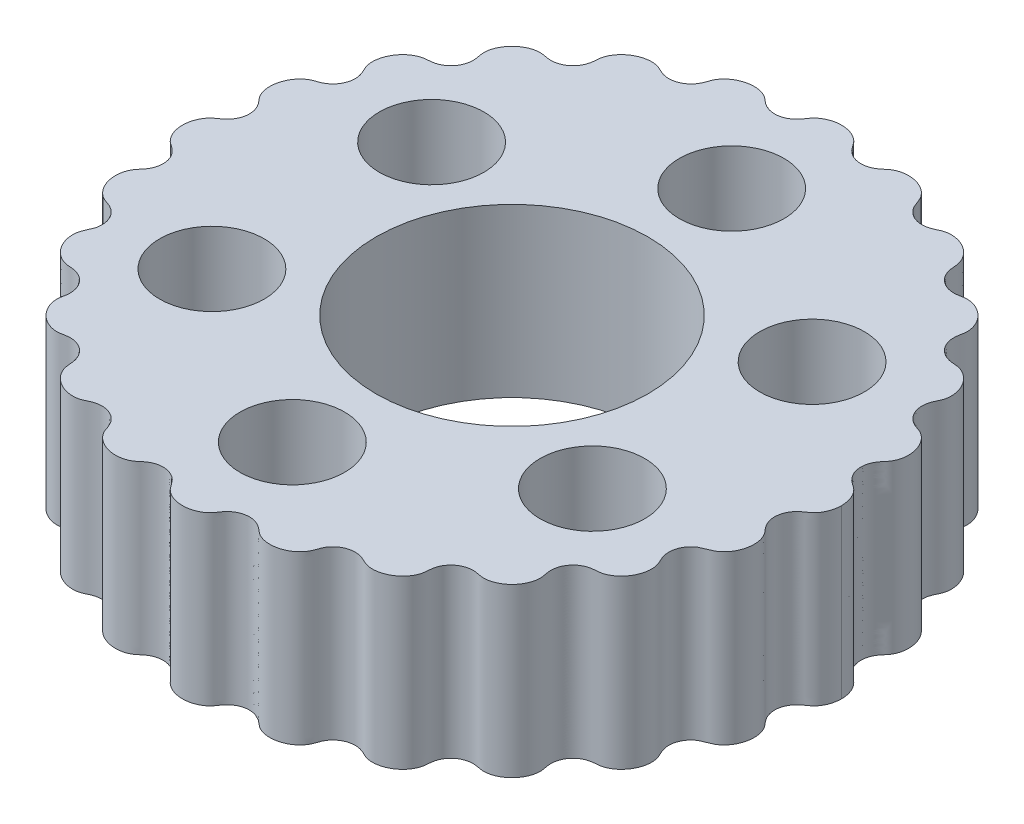
from build123d import *

# Parameters (mm, degrees)
BOSS_EXTRUDE1_DEPTH = 16
SKETCH3_R           = 13
SKETCH3_R_2         = 5
CUT_EXTRUDE1_DEPTH  = 48.333920573


with BuildPart() as part:
    # Sketch2 → Boss-Extrude1 (new body)
    with BuildSketch(Plane(origin=(0, 0, 0), x_dir=(1, 0, 0), z_dir=(0, 1, 0))):
        with BuildLine():
            add(Edge.make_bspline(
                [(31.5, 0), (31.5, 0.018707094), (31.499647262, 0.046556201), (31.49665689, 0.145689227), (31.492288109, 0.224284634), (31.488426988, 0.272324891), (31.468594049, 0.442031488), (31.454667211, 0.52772823), (31.418461905, 0.701318002), (31.391273355, 0.804295531), (31.345438102, 0.953526271), (31.289141961, 1.106553602), (31.196089005, 1.316424665), (31.068457715, 1.537292497), (30.946926271, 1.705519498), (30.843628387, 1.826239224), (30.762921468, 1.910596859), (30.678253622, 1.989375531), (30.606825192, 2.048777709), (30.538136438, 2.101063666), (30.4932005, 2.133440844), (30.416704275, 2.186228387), (30.357541167, 2.225641819), (30.26991417, 2.284659037), (30.176288437, 2.349687287), (30.042956129, 2.451848804), (29.836743046, 2.625837329), (29.560501481, 2.968461803), (29.317106697, 3.427905792), (29.199140575, 4.074961852), (29.271448681, 4.623824701), (29.415596965, 5.010592931), (29.569381549, 5.289588802), (29.691273975, 5.458253228), (29.78640646, 5.57677217), (29.866712574, 5.670412987), (29.933423814, 5.746227647), (29.986065461, 5.807247231), (30.030137995, 5.860427814), (30.068653885, 5.909345981), (30.115777796, 5.972626488), (30.168791174, 6.050595998), (30.228391176, 6.150047539), (30.301265416, 6.289028504), (30.380437742, 6.476042322), (30.454314744, 6.71962428), (30.504625478, 6.977034794), (30.53867243, 7.333244504), (30.517275562, 7.792518497), (30.389407304, 8.335622985), (30.202890123, 8.75881341), (30.012073039, 9.066468876), (29.850671577, 9.278290194), (29.673339984, 9.468643457), (29.515482971, 9.606545168), (29.386020162, 9.702532705), (29.287226838, 9.767656611), (29.186331636, 9.826271954), (29.083773005, 9.878307198), (28.994244377, 9.917446973), (28.919876821, 9.946365071), (28.852099457, 9.970841516), (28.773926011, 9.997620972), (28.690368424, 10.026381799), (28.619069105, 10.051378731), (28.506412616, 10.092834983), (28.331032792, 10.166197003), (28.119618821, 10.281829125), (27.889940929, 10.433963214), (27.549152213, 10.749639827), (27.223664771, 11.277074046), (27.0812132, 11.882898091), (27.105506252, 12.483661877), (27.215572331, 12.820499885), (27.289063003, 13.011150179), (27.343124009, 13.12731914), (27.379727701, 13.203537106), (27.417479849, 13.280175307), (27.450296815, 13.347229076), (27.48163186, 13.414263112), (27.514745075, 13.489645282), (27.550704454, 13.581275799), (27.586189616, 13.689891431), (27.615845108, 13.801743315), (27.639699238, 13.91799579), (27.663480832, 14.078235866), (27.677574755, 14.286902081), (27.668375759, 14.546685699), (27.632675504, 14.810862748), (27.550078854, 15.163297025), (27.382725034, 15.594373399), (27.089111297, 16.068842626), (26.779479958, 16.408723951), (26.503529458, 16.636522936), (26.285917352, 16.782977508), (26.061461985, 16.902963569), (25.873278419, 16.979201764), (25.723294208, 17.026001688), (25.611104227, 17.054117549), (25.518382039, 17.071774542), (25.440017688, 17.083248878), (25.378574488, 17.090554028), (25.310110177, 17.096973528), (25.22787132, 17.103026993), (25.130393196, 17.109281659), (25.004493246, 17.118788414), (24.854920495, 17.135643962), (24.649367755, 17.167372392), (24.337331791, 17.260000558), (23.977200336, 17.421974221), (23.520198806, 17.773124929), (23.156612124, 18.304092176), (23.00101127, 18.80335534), (22.965791133, 19.133359599), (22.965711398, 19.344144187), (22.979806569, 19.540691954), (22.999789475, 19.675678079), (23.019424734, 19.788596299), (23.039444813, 19.890228829), (23.054870625, 19.968002691), (23.069554239, 20.047593584), (23.079840878, 20.111200413), (23.090776729, 20.191853934), (23.099587312, 20.286699024), (23.103638066, 20.401340873), (23.101081254, 20.518483947), (23.088708482, 20.677181064), (23.056028784, 20.880908407), (22.989012557, 21.129405886), (22.863637339, 21.459042263), (22.641985517, 21.8576488), (22.285885215, 22.285889925), (21.857640582, 22.641991984), (21.459034067, 22.863641256), (21.129381178, 22.989021165), (20.880947347, 23.056020102), (20.677118172, 23.088715616), (20.518466803, 23.101083162), (20.401412452, 23.103639965), (20.286513632, 23.099579592), (20.19209143, 23.090787145), (20.111215155, 23.079852234), (20.045769298, 23.069220706), (19.972606138, 23.055853429), (19.886239167, 23.038319628), (19.786531092, 23.019501191), (19.68581314, 23.000197576), (19.492910734, 22.976597455), (19.260745776, 22.953759577), (18.793613935, 23.001396913), (18.297039888, 23.162947416), (17.785332438, 23.507774745), (17.412459245, 23.99044059), (17.263155458, 24.333162046), (17.168237051, 24.640867018), (17.133578916, 24.869736928), (17.119620797, 25.000252789), (17.109701415, 25.120477754), (17.102493903, 25.232130819), (17.096572727, 25.315065084), (17.090717266, 25.37802527), (17.083450976, 25.439181097), (17.072038213, 25.516771393), (17.05398843, 25.611408027), (17.025760726, 25.724063306), (16.979255658, 25.873242048), (16.903122822, 26.061120923), (16.782850555, 26.286101465), (16.636489449, 26.503584653), (16.408815362, 26.779383052), (16.068762705, 27.089175387), (15.594398504, 27.382714196), (15.16327968, 27.550076435), (14.810737134, 27.632711402), (14.546865619, 27.668358062), (14.287012742, 27.677557479), (14.077630121, 27.663431328), (13.918102008, 27.639760631), (13.80256874, 27.616020894), (13.690105471, 27.586213226), (13.580058849, 27.550210029), (13.489570299, 27.514826825), (13.413751161, 27.481503046), (13.353577227, 27.453273338), (13.281006433, 27.417548263), (13.197445605, 27.376648166), (13.119241857, 27.339271837), (13.02011704, 27.29441653), (12.855661579, 27.225158663), (12.607383331, 27.151995791), (12.340695833, 27.09999412), (11.886056357, 27.078879285), (11.261031206, 27.2316896), (10.763941968, 27.53905273), (10.325474825, 28.005814077), (10.185596311, 28.30178572), (10.094298451, 28.498277078), (10.051754503, 28.618732512), (10.024921396, 28.694050535), (9.996058414, 28.779102778), (9.972222446, 28.84864923), (9.947599393, 28.916532694), (9.916694184, 28.995825456), (9.877868629, 29.084673245), (9.826423827, 29.186144182), (9.767869818, 29.286913953), (9.702636207, 29.385843007), (9.606359908, 29.5156837), (9.468580068, 29.673419233), (9.278424448, 29.850564623), (9.066408547, 30.01210438), (8.758782836, 30.202914134), (8.335593913, 30.389402498), (7.79259839, 30.517274158), (7.333098516, 30.538669052), (6.977124096, 30.50463937), (6.719698522, 30.454322357), (6.4756844, 30.380318513), (6.289249372, 30.301389215), (6.150363892, 30.228533705), (6.050683208, 30.168805347), (5.971469846, 30.114982712), (5.908473019, 30.068109694), (5.861891188, 30.031401251), (5.811207973, 29.989304802), (5.743867349, 29.931048872), (5.665135266, 29.86229659), (5.580543, 29.789850881), (5.463767338, 29.695020698), (5.281380569, 29.563529418), (5.007353095, 29.415571608), (4.638388151, 29.273995931), (4.061846392, 29.19861853), (3.431247037, 29.317594955), (2.970472505, 29.558438773), (2.62256037, 29.839836748), (2.454891221, 30.039574526), (2.347470149, 30.17902247), (2.284971682, 30.269681791), (2.228441447, 30.353122914), (2.180903624, 30.424577141), (2.137596211, 30.487355575), (2.099130996, 30.540713578), (2.04987394, 30.605380869), (1.988900893, 30.678873324), (1.91086959, 30.762609033), (1.826200532, 30.843666056), (1.705187844, 30.947169148), (1.538043831, 31.06810619), (1.314953579, 31.196426526), (0.993195123, 31.340868698), (0.55461386, 31.465991025), (1.3458e-05, 31.51700619), (-0.554648335, 31.465986218), (-0.993160441, 31.340880639), (-1.315020838, 31.196394278), (-1.537975243, 31.068150749), (-1.705140294, 30.947203987), (-1.826479699, 30.843417186), (-1.910504036, 30.763001104), (-1.989141691, 30.678582026), (-2.049855661, 30.605380436), (-2.099254715, 30.540583738), (-2.137292047, 30.487757306), (-2.181162988, 30.424217119), (-2.228152849, 30.35350908), (-2.285422691, 30.269090183), (-2.346439208, 30.180265932), (-2.456774176, 30.03763177), (-2.621017483, 29.840734466), (-2.973163662, 29.556907603), (-3.429154343, 29.318331745), (-4.064140363, 29.198352639), (-4.637053026, 29.274134604), (-5.004379998, 29.413928941), (-5.287834706, 29.567102379), (-5.463238562, 29.695454253), (-5.571993203, 29.782432829), (-5.676028024, 29.871437525), (-5.742069288, 29.929950095), (-5.808323452, 29.986922943), (-5.860680607, 30.030341802), (-5.909179807, 30.068537732), (-5.972552428, 30.115722519), (-6.050673233, 30.16884468), (-6.149981102, 30.228351631), (-6.289071501, 30.301285395), (-6.476023364, 30.38043206), (-6.719616391, 30.454312866), (-6.977037099, 30.50462527), (-7.333237984, 30.538671755), (-7.792514569, 30.517280726), (-8.335638951, 30.389394199), (-8.758780576, 30.20291333), (-9.066418305, 30.012098079), (-9.278426851, 29.85056252), (-9.46858503, 29.673414241), (-9.606363682, 29.515679049), (-9.702638947, 29.385839032), (-9.767872607, 29.286909354), (-9.82642703, 29.186138331), (-9.877871176, 29.084667964), (-9.916695217, 28.99582297), (-9.94760195, 28.916525669), (-9.972225992, 28.848639404), (-9.996059933, 28.77909803), (-10.024926978, 28.694034283), (-10.051760169, 28.618716419), (-10.094310899, 28.49824558), (-10.185613358, 28.301749322), (-10.325538885, 28.005704477), (-10.764098415, 27.538921342), (-11.261252288, 27.231594134), (-11.886279632, 27.078863489), (-12.340819504, 27.100012945), (-12.607466404, 27.152016159), (-12.855711115, 27.225178051), (-13.0201416, 27.294427328), (-13.119257301, 27.339279092), (-13.19745906, 27.376654687), (-13.281015858, 27.417552938), (-13.3535838, 27.453276503), (-13.413756432, 27.481505442), (-13.489575603, 27.514829018), (-13.580063909, 27.550211841), (-13.690110718, 27.58621478), (-13.80257409, 27.616022151), (-13.918107531, 27.639761607), (-14.077635923, 27.663431926), (-14.287018777, 27.677557573), (-14.546871791, 27.668357535), (-14.810743362, 27.632710252), (-15.163285859, 27.550074468), (-15.594404383, 27.382711265), (-16.068767936, 27.089171443), (-16.408819835, 26.779378432), (-16.636493185, 26.503579652), (-16.782853699, 26.286096247), (-16.903125324, 26.061115586), (-16.97925757, 25.873236783), (-17.025762208, 25.724058035), (-17.053989604, 25.611402695), (-17.07203913, 25.516766046), (-17.083451721, 25.439175497), (-17.090717881, 25.378019448), (-17.096573251, 25.315058649), (-17.102494514, 25.232121311), (-17.109702453, 25.12046261), (-17.119622507, 25.00023447), (-17.133582798, 24.869702756), (-17.168250366, 24.640801459), (-17.26319143, 24.333060878), (-17.412549644, 23.990274243), (-17.785514256, 23.507604546), (-18.297233068, 23.162856831), (-18.793784893, 23.001364142), (-19.26081645, 22.953766551), (-19.492956615, 22.976600526), (-19.685836451, 23.000202126), (-19.786548779, 23.019504321), (-19.886251096, 23.03832222), (-19.97261152, 23.055854337), (-20.045779535, 23.069222559), (-20.111219163, 23.079852879), (-20.192095403, 23.090787579), (-20.286520203, 23.099579938), (-20.401418711, 23.103640023), (-20.518471861, 23.10108296), (-20.677123085, 23.088715032), (-20.880954852, 23.056018405), (-21.129384458, 22.989020184), (-21.459044481, 22.863635988), (-21.857630179, 22.641999602), (-22.285915131, 22.285863889), (-22.641959654, 21.857673241), (-22.863671054, 21.458987284), (-22.98895211, 21.129559949), (-23.056078325, 20.880669708), (-23.088742703, 20.677093965), (-23.101061429, 20.518846029), (-23.103601878, 20.4017267), (-23.099537367, 20.28621507), (-23.090649455, 20.19024056), (-23.080017934, 20.111759198), (-23.070054341, 20.05061728), (-23.055592354, 19.972767304), (-23.037197273, 19.879769135), (-23.01928136, 19.786068677), (-23.001785663, 19.688475258), (-22.979040094, 19.537046699), (-22.96559183, 19.338063571), (-22.966114004, 19.134262477), (-22.999939902, 18.807131995), (-23.157459801, 18.301816105), (-23.52040981, 17.77327795), (-23.977206223, 17.421830088), (-24.338164535, 17.259756224), (-24.647622142, 17.167809819), (-24.858552581, 17.135071296), (-25.001503955, 17.119147939), (-25.133170375, 17.10897628), (-25.225856707, 17.103243141), (-25.310480029, 17.096915039), (-25.378788938, 17.090531514), (-25.440024212, 17.083251018), (-25.518317582, 17.071788203), (-25.611106746, 17.054115969), (-25.723313751, 17.025994976), (-25.873288978, 16.979198329), (-26.06145902, 16.902965244), (-26.285925761, 16.782972343), (-26.503534142, 16.63651936), (-26.779484223, 16.408719801), (-27.089114926, 16.068838089), (-27.382728496, 15.594366284), (-27.55008053, 15.163291851), (-27.632676674, 14.810856179), (-27.668376356, 14.546679086), (-27.677574677, 14.28689666), (-27.663480225, 14.078230134), (-27.639698144, 13.917989693), (-27.615843959, 13.801738065), (-27.586187913, 13.689886253), (-27.550703943, 13.581273503), (-27.514738724, 13.489630329), (-27.481632679, 13.414264921), (-27.450291029, 13.347216921), (-27.417476386, 13.280168569), (-27.379722236, 13.203525389), (-27.343114534, 13.127301662), (-27.289051299, 13.01111393), (-27.215555209, 12.820488005), (-27.105484879, 12.483467351), (-27.081216566, 11.882857487), (-27.223777759, 11.276375639), (-27.550180323, 10.748896067), (-27.886466791, 10.436796851), (-28.120932897, 10.28058799), (-28.338778382, 10.162644571), (-28.49847929, 10.096433273), (-28.614178059, 10.0527583), (-28.699951051, 10.02302444), (-28.776082366, 9.99714893), (-28.848148816, 9.972366836), (-28.917467906, 9.947238917), (-28.995372355, 9.916885157), (-29.084786121, 9.87781913), (-29.18610479, 9.826442887), (-29.286893189, 9.767881822), (-29.385875083, 9.702611738), (-29.5156847, 9.606362573), (-29.67339608, 9.468601417), (-29.850576055, 9.278410279), (-30.012100231, 9.066415949), (-30.202910728, 8.758784459), (-30.389396418, 8.335636283), (-30.51728161, 7.792503757), (-30.538671598, 7.333246105), (-30.504623278, 6.977020829), (-30.45431327, 6.71961533), (-30.380441583, 6.476053181), (-30.301256517, 6.28901189), (-30.228383888, 6.150032987), (-30.168792887, 6.050597334), (-30.115795311, 5.972651609), (-30.068635623, 5.909324412), (-30.0301115, 5.860395243), (-29.985940984, 5.807085262), (-29.934168434, 5.74714131), (-29.865200685, 5.668580967), (-29.788217462, 5.57896471), (-29.689207143, 5.455812638), (-29.569864061, 5.289453397), (-29.417480631, 5.015248827), (-29.269339276, 4.618685495), (-29.200834263, 4.070138577), (-29.313120901, 3.438085626), (-29.565518504, 2.959912331), (-29.764051688, 2.715914833), (-29.916302218, 2.561483293), (-30.070399807, 2.428690335), (-30.180832373, 2.347374813), (-30.261379686, 2.290484499), (-30.352313245, 2.228732356), (-30.429649463, 2.177329542), (-30.488648652, 2.136835153), (-30.538756061, 2.100661647), (-30.604553838, 2.050501522), (-30.680084104, 1.987771216), (-30.762597886, 1.910938511), (-30.843077969, 1.826843938), (-30.947805994, 1.704397103), (-31.06762577, 1.538673049), (-31.196574662, 1.314833698), (-31.341036912, 0.992786711), (-31.466492172, 0.55090606), (-31.5, 0.183219945), (-31.5, 0)],
                knots=[0.071647033, 0.071647033, 0.071647033, 0.071647033, 0.07248366, 0.073320287, 0.074156914, 0.07499354, 0.076666794, 0.078340048, 0.080013302, 0.081686556, 0.083359809, 0.085033063, 0.088379571, 0.091726078, 0.095072586, 0.096745839, 0.098419093, 0.100092347, 0.101765601, 0.102602228, 0.103438855, 0.104275481, 0.105112108, 0.105530422, 0.105948735, 0.106367049, 0.106785362, 0.106994519, 0.107203676, 0.107412832, 0.107621989, 0.107831146, 0.108040302, 0.108458616, 0.108876929, 0.109295243, 0.11013187, 0.110968497, 0.111805123, 0.11264175, 0.113478377, 0.115151631, 0.116824885, 0.118498138, 0.121844646, 0.125191154, 0.128537661, 0.131884169, 0.138577184, 0.145270199, 0.151963214, 0.155309721, 0.158656229, 0.162002737, 0.165349244, 0.167022498, 0.168695752, 0.170369005, 0.172042259, 0.173715513, 0.17455214, 0.175388767, 0.176225394, 0.176643707, 0.17706202, 0.177480334, 0.177898647, 0.178107804, 0.178316961, 0.178526117, 0.178735274, 0.178944431, 0.179153588, 0.179571901, 0.179990215, 0.180408528, 0.180826841, 0.181245155, 0.182081782, 0.182918409, 0.183755036, 0.185428289, 0.187101543, 0.188774797, 0.190448051, 0.192121304, 0.195467812, 0.198814319, 0.202160827, 0.205507335, 0.21220035, 0.218893365, 0.22558638, 0.228932887, 0.232279395, 0.235625902, 0.23897241, 0.240645664, 0.242318917, 0.243992171, 0.244828798, 0.245665425, 0.246502052, 0.247338679, 0.248175306, 0.248593619, 0.249011933, 0.249430246, 0.249639403, 0.249848559, 0.250057716, 0.250266873, 0.25047603, 0.250685186, 0.250894343, 0.2511035, 0.251521813, 0.251940127, 0.25235844, 0.253195067, 0.254031694, 0.254868321, 0.255704948, 0.257378201, 0.259051455, 0.260724709, 0.262397963, 0.26574447, 0.269090978, 0.272437485, 0.2791305, 0.285823515, 0.292516531, 0.299209546, 0.302556053, 0.305902561, 0.309249068, 0.310922322, 0.312595576, 0.31426883, 0.315942083, 0.31677871, 0.317615337, 0.318451964, 0.319288591, 0.319706904, 0.320125218, 0.320543531, 0.320961845, 0.321171001, 0.321380158, 0.321589315, 0.321798472, 0.322007628, 0.322216785, 0.322635098, 0.323053412, 0.323471725, 0.324308352, 0.325144979, 0.325981606, 0.326818233, 0.32765486, 0.329328114, 0.331001367, 0.332674621, 0.336021129, 0.339367636, 0.342714144, 0.346060651, 0.352753666, 0.359446681, 0.366139696, 0.369486204, 0.372832712, 0.376179219, 0.379525727, 0.38119898, 0.382872234, 0.384545488, 0.386218742, 0.387891995, 0.388728622, 0.389565249, 0.390401876, 0.39082019, 0.391238503, 0.391656816, 0.39207513, 0.392284287, 0.392493443, 0.3927026, 0.392911757, 0.393120913, 0.39333007, 0.393748384, 0.394166697, 0.394585011, 0.395003324, 0.395421637, 0.396258264, 0.397094891, 0.397931518, 0.399604772, 0.401278026, 0.402951279, 0.404624533, 0.406297787, 0.409644294, 0.412990802, 0.41633731, 0.419683817, 0.426376832, 0.433069847, 0.439762862, 0.44310937, 0.446455877, 0.449802385, 0.453148892, 0.454822146, 0.4564954, 0.458168654, 0.459005281, 0.459841908, 0.460678534, 0.461515161, 0.462351788, 0.462770102, 0.463188415, 0.463606729, 0.463815885, 0.464025042, 0.464234199, 0.464443355, 0.464652512, 0.464861669, 0.465279982, 0.465698296, 0.466116609, 0.466534923, 0.46737155, 0.468208176, 0.469044803, 0.46988143, 0.471554684, 0.473227938, 0.474901192, 0.476574445, 0.479920953, 0.48326746, 0.486613968, 0.493306983, 0.499999998, 0.506693013, 0.513386028, 0.516732536, 0.520079043, 0.523425551, 0.525098805, 0.526772058, 0.528445312, 0.530118566, 0.530955193, 0.53179182, 0.532628447, 0.533465073, 0.533883387, 0.5343017, 0.534720014, 0.535138327, 0.535347484, 0.535556641, 0.535765797, 0.535974954, 0.536184111, 0.536393268, 0.536811581, 0.537229894, 0.537648208, 0.538484835, 0.539321462, 0.540158089, 0.540994715, 0.541831342, 0.543504596, 0.54517785, 0.546851104, 0.550197611, 0.553544119, 0.556890626, 0.560237134, 0.566930149, 0.573623164, 0.580316179, 0.583662687, 0.587009194, 0.590355702, 0.593702209, 0.595375463, 0.597048717, 0.59872197, 0.600395224, 0.602068478, 0.602905105, 0.603741732, 0.604578359, 0.604996672, 0.605414986, 0.605833299, 0.606251612, 0.606669926, 0.606879083, 0.607088239, 0.607297396, 0.607506553, 0.60771571, 0.607924866, 0.60834318, 0.608761493, 0.609179807, 0.60959812, 0.610434747, 0.611271374, 0.612108001, 0.613781254, 0.615454508, 0.617127762, 0.618801016, 0.62047427, 0.623820777, 0.627167285, 0.630513792, 0.6338603, 0.640553315, 0.64724633, 0.653939345, 0.657285852, 0.66063236, 0.663978868, 0.667325375, 0.668998629, 0.670671883, 0.672345136, 0.673181763, 0.67401839, 0.674855017, 0.675691644, 0.676528271, 0.676946584, 0.677364898, 0.677783211, 0.677992368, 0.678201525, 0.678410681, 0.678619838, 0.678828995, 0.679038151, 0.679456465, 0.679874778, 0.680293092, 0.680711405, 0.681548032, 0.682384659, 0.683221286, 0.684057913, 0.685731167, 0.68740442, 0.689077674, 0.690750928, 0.694097435, 0.697443943, 0.70079045, 0.707483466, 0.714176481, 0.720869496, 0.727562511, 0.730909018, 0.734255526, 0.737602033, 0.739275287, 0.740948541, 0.742621795, 0.744295048, 0.745131675, 0.745968302, 0.746804929, 0.747641556, 0.748059869, 0.748478183, 0.748896496, 0.749105653, 0.74931481, 0.749523967, 0.749733123, 0.74994228, 0.750151437, 0.750360593, 0.75056975, 0.750988064, 0.751406377, 0.75182469, 0.752661317, 0.753497944, 0.754334571, 0.755171198, 0.756007825, 0.757681079, 0.759354332, 0.761027586, 0.764374094, 0.767720601, 0.771067109, 0.774413616, 0.781106631, 0.787799647, 0.794492662, 0.797839169, 0.801185677, 0.804532184, 0.807878692, 0.809551946, 0.811225199, 0.812898453, 0.814571707, 0.816244961, 0.817081587, 0.817918214, 0.818754841, 0.819173155, 0.819591468, 0.820009782, 0.820428095, 0.820846408, 0.821055565, 0.821264722, 0.821473879, 0.821683035, 0.821892192, 0.822101349, 0.822519662, 0.822937976, 0.823356289, 0.823774603, 0.824611229, 0.825447856, 0.826284483, 0.827957737, 0.829630991, 0.831304245, 0.832977498, 0.834650752, 0.83799726, 0.841343767, 0.844690275, 0.848036782, 0.854729797, 0.861422812, 0.868115827, 0.871462335, 0.874808843, 0.87815535, 0.881501858, 0.883175111, 0.884848365, 0.886521619, 0.887358246, 0.888194873, 0.8890315, 0.889868126, 0.890704753, 0.891123067, 0.89154138, 0.891959694, 0.89216885, 0.892378007, 0.892587164, 0.892796321, 0.893005477, 0.893214634, 0.893423791, 0.893632947, 0.894051261, 0.894469574, 0.894887888, 0.895724515, 0.896561142, 0.897397768, 0.898234395, 0.899907649, 0.901580903, 0.903254157, 0.90492741, 0.908273918, 0.911620426, 0.914966933, 0.921659948, 0.928352963, 0.928352963, 0.928352963, 0.928352963], degree=3))
            add(Edge.make_bspline(
                [(-31.5, 0), (-31.5, -0.183219945), (-31.466492172, -0.55090606), (-31.341036912, -0.992786711), (-31.196574662, -1.314833698), (-31.06762577, -1.538673049), (-30.947805994, -1.704397103), (-30.843077969, -1.826843938), (-30.762597886, -1.910938511), (-30.680084104, -1.987771216), (-30.604553838, -2.050501522), (-30.538756061, -2.100661647), (-30.488648652, -2.136835153), (-30.429649463, -2.177329542), (-30.352313245, -2.228732356), (-30.261379686, -2.290484499), (-30.180832373, -2.347374813), (-30.070399807, -2.428690335), (-29.916302218, -2.561483293), (-29.764051688, -2.715914833), (-29.565518504, -2.959912331), (-29.313120901, -3.438085626), (-29.200834263, -4.070138577), (-29.269339276, -4.618685495), (-29.417480631, -5.015248827), (-29.569864061, -5.289453397), (-29.689207143, -5.455812638), (-29.788217462, -5.57896471), (-29.865200685, -5.668580967), (-29.934168434, -5.74714131), (-29.985940984, -5.807085262), (-30.0301115, -5.860395243), (-30.068635623, -5.909324412), (-30.115795311, -5.972651609), (-30.168792887, -6.050597334), (-30.228383888, -6.150032987), (-30.301256517, -6.28901189), (-30.380441583, -6.476053181), (-30.45431327, -6.71961533), (-30.504623278, -6.977020829), (-30.538671598, -7.333246105), (-30.51728161, -7.792503757), (-30.389396418, -8.335636283), (-30.202910728, -8.758784459), (-30.012100231, -9.066415949), (-29.850576055, -9.278410279), (-29.67339608, -9.468601417), (-29.5156847, -9.606362573), (-29.385875083, -9.702611738), (-29.286893189, -9.767881822), (-29.18610479, -9.826442887), (-29.084786121, -9.87781913), (-28.995372355, -9.916885157), (-28.917467906, -9.947238917), (-28.848148816, -9.972366836), (-28.776082366, -9.99714893), (-28.699951051, -10.02302444), (-28.614178059, -10.0527583), (-28.49847929, -10.096433273), (-28.338778382, -10.162644571), (-28.120932897, -10.28058799), (-27.886466791, -10.436796851), (-27.550180323, -10.748896067), (-27.223777759, -11.276375639), (-27.081216566, -11.882857487), (-27.105484879, -12.483467351), (-27.215555209, -12.820488005), (-27.289051299, -13.01111393), (-27.343114534, -13.127301662), (-27.379722236, -13.203525389), (-27.417476386, -13.280168569), (-27.450291029, -13.347216921), (-27.481632679, -13.414264921), (-27.514738724, -13.489630329), (-27.550703943, -13.581273503), (-27.586187913, -13.689886253), (-27.615843959, -13.801738065), (-27.639698144, -13.917989693), (-27.663480225, -14.078230134), (-27.677574677, -14.28689666), (-27.668376356, -14.546679086), (-27.632676674, -14.810856179), (-27.55008053, -15.163291851), (-27.382728496, -15.594366284), (-27.089114926, -16.068838089), (-26.779484223, -16.408719801), (-26.503534142, -16.63651936), (-26.285925761, -16.782972343), (-26.06145902, -16.902965244), (-25.873288978, -16.979198329), (-25.723313751, -17.025994976), (-25.611106746, -17.054115969), (-25.518317582, -17.071788203), (-25.440024212, -17.083251018), (-25.378788938, -17.090531514), (-25.310480029, -17.096915039), (-25.225856707, -17.103243141), (-25.133170375, -17.10897628), (-25.001503955, -17.119147939), (-24.858552581, -17.135071296), (-24.647622142, -17.167809819), (-24.338164535, -17.259756224), (-23.977206223, -17.421830088), (-23.52040981, -17.77327795), (-23.157459801, -18.301816105), (-22.999939902, -18.807131995), (-22.966114003, -19.134262477), (-22.96559183, -19.338063571), (-22.979040094, -19.537046699), (-23.001785663, -19.688475258), (-23.01928136, -19.786068677), (-23.037197273, -19.879769135), (-23.055592354, -19.972767304), (-23.070054341, -20.05061728), (-23.080017934, -20.111759198), (-23.090649455, -20.19024056), (-23.099537367, -20.28621507), (-23.103601878, -20.4017267), (-23.101061429, -20.518846029), (-23.088742703, -20.677093965), (-23.056078325, -20.880669708), (-22.98895211, -21.129559949), (-22.863671054, -21.458987284), (-22.641959654, -21.857673241), (-22.285915131, -22.285863889), (-21.857630179, -22.641999602), (-21.459044481, -22.863635988), (-21.129384458, -22.989020184), (-20.880954852, -23.056018405), (-20.677123085, -23.088715032), (-20.518471861, -23.10108296), (-20.401418711, -23.103640023), (-20.286520203, -23.099579938), (-20.192095403, -23.090787579), (-20.111219163, -23.079852879), (-20.045779535, -23.069222559), (-19.97261152, -23.055854337), (-19.886251096, -23.03832222), (-19.786548779, -23.019504321), (-19.685836451, -23.000202126), (-19.492956615, -22.976600526), (-19.26081645, -22.953766551), (-18.793784893, -23.001364142), (-18.297233068, -23.162856831), (-17.785514256, -23.507604546), (-17.412549644, -23.990274243), (-17.26319143, -24.333060878), (-17.168250366, -24.640801459), (-17.133582798, -24.869702756), (-17.119622507, -25.00023447), (-17.109702453, -25.12046261), (-17.102494514, -25.232121311), (-17.096573251, -25.315058649), (-17.090717881, -25.378019448), (-17.083451721, -25.439175497), (-17.07203913, -25.516766046), (-17.053989604, -25.611402695), (-17.025762208, -25.724058035), (-16.97925757, -25.873236783), (-16.903125324, -26.061115586), (-16.782853699, -26.286096247), (-16.636493185, -26.503579652), (-16.408819835, -26.779378432), (-16.068767936, -27.089171443), (-15.594404383, -27.382711265), (-15.163285859, -27.550074468), (-14.810743362, -27.632710252), (-14.546871791, -27.668357535), (-14.287018777, -27.677557573), (-14.077635923, -27.663431926), (-13.918107531, -27.639761607), (-13.80257409, -27.616022151), (-13.690110718, -27.58621478), (-13.580063909, -27.550211841), (-13.489575603, -27.514829018), (-13.413756432, -27.481505442), (-13.353583799, -27.453276503), (-13.281015858, -27.417552938), (-13.19745906, -27.376654687), (-13.119257301, -27.339279092), (-13.0201416, -27.294427328), (-12.855711115, -27.225178051), (-12.607466404, -27.152016159), (-12.340819504, -27.100012945), (-11.886279632, -27.078863489), (-11.261252288, -27.231594134), (-10.764098415, -27.538921342), (-10.325538885, -28.005704477), (-10.185613358, -28.301749322), (-10.094310899, -28.49824558), (-10.051760169, -28.618716419), (-10.024926978, -28.694034283), (-9.996059933, -28.77909803), (-9.972225992, -28.848639404), (-9.94760195, -28.916525669), (-9.916695217, -28.99582297), (-9.877871176, -29.084667964), (-9.82642703, -29.186138331), (-9.767872607, -29.286909354), (-9.702638947, -29.385839032), (-9.606363682, -29.515679049), (-9.46858503, -29.673414241), (-9.278426851, -29.85056252), (-9.066418305, -30.012098079), (-8.758780576, -30.20291333), (-8.335638951, -30.389394199), (-7.792514569, -30.517280726), (-7.333237984, -30.538671755), (-6.977037099, -30.50462527), (-6.719616391, -30.454312866), (-6.476023364, -30.38043206), (-6.289071501, -30.301285395), (-6.149981102, -30.228351631), (-6.050673233, -30.16884468), (-5.972552428, -30.115722519), (-5.909179807, -30.068537732), (-5.860680607, -30.030341802), (-5.808323452, -29.986922943), (-5.742069288, -29.929950095), (-5.676028024, -29.871437525), (-5.571993203, -29.782432829), (-5.463238562, -29.695454253), (-5.287834706, -29.567102379), (-5.004379998, -29.413928941), (-4.637053026, -29.274134604), (-4.064140363, -29.198352639), (-3.429154343, -29.318331745), (-2.973163662, -29.556907603), (-2.621017483, -29.840734466), (-2.456774176, -30.03763177), (-2.346439208, -30.180265932), (-2.285422691, -30.269090183), (-2.228152849, -30.35350908), (-2.181162988, -30.424217119), (-2.137292047, -30.487757306), (-2.099254715, -30.540583738), (-2.049855661, -30.605380436), (-1.989141691, -30.678582026), (-1.910504036, -30.763001104), (-1.826479699, -30.843417186), (-1.705140294, -30.947203987), (-1.537975243, -31.068150749), (-1.315020838, -31.196394278), (-0.993160441, -31.340880639), (-0.554648335, -31.465986218), (1.3458e-05, -31.51700619), (0.55461386, -31.465991025), (0.993195123, -31.340868698), (1.314953579, -31.196426526), (1.538043831, -31.06810619), (1.705187844, -30.947169148), (1.826200532, -30.843666056), (1.91086959, -30.762609033), (1.988900893, -30.678873324), (2.04987394, -30.605380869), (2.099130996, -30.540713578), (2.137596211, -30.487355575), (2.180903624, -30.424577141), (2.228441447, -30.353122914), (2.284971682, -30.269681791), (2.347470149, -30.17902247), (2.454891221, -30.039574526), (2.62256037, -29.839836748), (2.970472505, -29.558438773), (3.431247037, -29.317594955), (4.061846392, -29.19861853), (4.638388151, -29.273995931), (5.007353095, -29.415571608), (5.281380569, -29.563529418), (5.463767338, -29.695020698), (5.580543, -29.789850881), (5.665135266, -29.86229659), (5.743867349, -29.931048872), (5.811207973, -29.989304802), (5.861891188, -30.031401251), (5.908473019, -30.068109694), (5.971469846, -30.114982712), (6.050683208, -30.168805347), (6.150363892, -30.228533705), (6.289249372, -30.301389215), (6.4756844, -30.380318513), (6.719698522, -30.454322357), (6.977124096, -30.50463937), (7.333098516, -30.538669052), (7.79259839, -30.517274158), (8.335593913, -30.389402498), (8.758782836, -30.202914134), (9.066408547, -30.01210438), (9.278424448, -29.850564623), (9.468580068, -29.673419233), (9.606359908, -29.5156837), (9.702636207, -29.385843007), (9.767869818, -29.286913953), (9.826423827, -29.186144182), (9.877868629, -29.084673245), (9.916694184, -28.995825456), (9.947599393, -28.916532694), (9.972222446, -28.84864923), (9.996058414, -28.779102778), (10.024921396, -28.694050535), (10.051754503, -28.618732512), (10.094298451, -28.498277078), (10.185596311, -28.30178572), (10.325474825, -28.005814077), (10.763941968, -27.53905273), (11.261031206, -27.2316896), (11.886056357, -27.078879285), (12.340695833, -27.09999412), (12.607383331, -27.151995791), (12.855661579, -27.225158663), (13.02011704, -27.29441653), (13.119241857, -27.339271837), (13.197445605, -27.376648166), (13.281006433, -27.417548263), (13.353577227, -27.453273338), (13.413751161, -27.481503046), (13.489570299, -27.514826825), (13.580058849, -27.550210029), (13.690105471, -27.586213226), (13.80256874, -27.616020894), (13.918102008, -27.639760631), (14.077630121, -27.663431328), (14.287012742, -27.677557479), (14.546865619, -27.668358062), (14.810737134, -27.632711402), (15.16327968, -27.550076435), (15.594398504, -27.382714196), (16.068762705, -27.089175387), (16.408815362, -26.779383052), (16.636489449, -26.503584653), (16.782850555, -26.286101465), (16.903122822, -26.061120923), (16.979255658, -25.873242048), (17.025760726, -25.724063306), (17.05398843, -25.611408027), (17.072038213, -25.516771393), (17.083450976, -25.439181097), (17.090717266, -25.37802527), (17.096572727, -25.315065084), (17.102493903, -25.232130819), (17.109701415, -25.120477754), (17.119620797, -25.000252789), (17.133578916, -24.869736928), (17.168237051, -24.640867018), (17.263155458, -24.333162046), (17.412459245, -23.99044059), (17.785332438, -23.507774745), (18.297039888, -23.162947416), (18.793613935, -23.001396913), (19.260745776, -22.953759577), (19.492910734, -22.976597455), (19.68581314, -23.000197576), (19.786531092, -23.019501191), (19.886239167, -23.038319628), (19.972606138, -23.055853429), (20.045769298, -23.069220706), (20.111215155, -23.079852234), (20.19209143, -23.090787145), (20.286513632, -23.099579592), (20.401412452, -23.103639965), (20.518466803, -23.101083162), (20.677118172, -23.088715616), (20.880947347, -23.056020102), (21.129381178, -22.989021165), (21.459034067, -22.863641256), (21.857640582, -22.641991984), (22.285885215, -22.285889925), (22.641985517, -21.8576488), (22.863637339, -21.459042263), (22.989012557, -21.129405886), (23.056028784, -20.880908407), (23.088708482, -20.677181064), (23.101081254, -20.518483947), (23.103638066, -20.401340873), (23.099587312, -20.286699024), (23.090776729, -20.191853934), (23.079840878, -20.111200413), (23.069554239, -20.047593584), (23.054870625, -19.968002691), (23.039444813, -19.890228829), (23.019424734, -19.788596299), (22.999789475, -19.675678079), (22.979806569, -19.540691954), (22.965711398, -19.344144187), (22.965791133, -19.133359599), (23.00101127, -18.80335534), (23.156612124, -18.304092176), (23.520198806, -17.773124929), (23.977200336, -17.421974221), (24.337331791, -17.260000558), (24.649367755, -17.167372392), (24.854920495, -17.135643962), (25.004493246, -17.118788414), (25.130393196, -17.109281659), (25.22787132, -17.103026993), (25.310110177, -17.096973528), (25.378574488, -17.090554028), (25.440017688, -17.083248878), (25.518382039, -17.071774542), (25.611104227, -17.054117549), (25.723294208, -17.026001688), (25.873278419, -16.979201764), (26.061461985, -16.902963569), (26.285917352, -16.782977508), (26.503529458, -16.636522936), (26.779479958, -16.408723951), (27.089111297, -16.068842626), (27.382725034, -15.594373399), (27.550078854, -15.163297025), (27.632675504, -14.810862748), (27.668375759, -14.546685699), (27.677574755, -14.286902081), (27.663480832, -14.078235866), (27.639699238, -13.91799579), (27.615845108, -13.801743315), (27.586189616, -13.689891431), (27.550704454, -13.581275799), (27.514745075, -13.489645282), (27.48163186, -13.414263112), (27.450296815, -13.347229076), (27.417479849, -13.280175307), (27.379727701, -13.203537106), (27.343124009, -13.12731914), (27.289063003, -13.011150179), (27.215572331, -12.820499885), (27.105506252, -12.483661877), (27.0812132, -11.882898091), (27.223664771, -11.277074046), (27.549152213, -10.749639827), (27.889940929, -10.433963214), (28.119618821, -10.281829125), (28.331032792, -10.166197003), (28.506412616, -10.092834983), (28.619069105, -10.051378731), (28.690368424, -10.026381799), (28.773926011, -9.997620972), (28.852099457, -9.970841516), (28.919876821, -9.946365071), (28.994244377, -9.917446973), (29.083773005, -9.878307198), (29.186331636, -9.826271954), (29.287226838, -9.767656611), (29.386020162, -9.702532705), (29.515482971, -9.606545168), (29.673339984, -9.468643457), (29.850671577, -9.278290194), (30.012073039, -9.066468876), (30.202890123, -8.75881341), (30.389407304, -8.335622985), (30.517275562, -7.792518497), (30.53867243, -7.333244504), (30.504625478, -6.977034794), (30.454314744, -6.71962428), (30.380437742, -6.476042322), (30.301265416, -6.289028504), (30.228391176, -6.150047539), (30.168791174, -6.050595998), (30.115777796, -5.972626488), (30.068653885, -5.909345981), (30.030137995, -5.860427814), (29.986065461, -5.807247231), (29.933423814, -5.746227647), (29.866712574, -5.670412987), (29.78640646, -5.57677217), (29.691273975, -5.458253228), (29.569381549, -5.289588802), (29.415596965, -5.010592931), (29.271448681, -4.623824701), (29.199140575, -4.074961852), (29.317106697, -3.427905792), (29.560501481, -2.968461803), (29.836743046, -2.625837329), (30.042956129, -2.451848804), (30.176288437, -2.349687287), (30.26991417, -2.284659037), (30.357541167, -2.225641819), (30.416704275, -2.186228387), (30.4932005, -2.133440844), (30.538136438, -2.101063666), (30.606825192, -2.048777709), (30.678253622, -1.989375531), (30.762921468, -1.910596859), (30.843628387, -1.826239224), (30.946926271, -1.705519498), (31.068457715, -1.537292497), (31.196089005, -1.316424665), (31.289141961, -1.106553602), (31.345438102, -0.953526271), (31.391273355, -0.804295531), (31.418461905, -0.701318002), (31.454667211, -0.52772823), (31.468594049, -0.442031488), (31.488426988, -0.272324891), (31.492288109, -0.224284634), (31.49665689, -0.145689227), (31.499647262, -0.046556201), (31.5, -0.018707094), (31.5, 0)],
                knots=[0.071647033, 0.071647033, 0.071647033, 0.071647033, 0.078340048, 0.085033063, 0.088379571, 0.091726078, 0.095072586, 0.096745839, 0.098419093, 0.100092347, 0.101765601, 0.102602228, 0.103438855, 0.104275481, 0.105112108, 0.105530422, 0.105948735, 0.106367049, 0.106576205, 0.106785362, 0.106994519, 0.107203676, 0.107412832, 0.107621989, 0.107831146, 0.108040302, 0.108458616, 0.108876929, 0.109295243, 0.11013187, 0.110968497, 0.111805123, 0.11264175, 0.113478377, 0.115151631, 0.116824885, 0.118498138, 0.121844646, 0.125191154, 0.128537661, 0.131884169, 0.138577184, 0.145270199, 0.151963214, 0.155309721, 0.158656229, 0.162002737, 0.165349244, 0.167022498, 0.168695752, 0.170369005, 0.172042259, 0.173715513, 0.17455214, 0.175388767, 0.176225394, 0.176643707, 0.17706202, 0.177480334, 0.177898647, 0.178107804, 0.178316961, 0.178526117, 0.178735274, 0.178944431, 0.179153588, 0.179571901, 0.179990215, 0.180408528, 0.180826841, 0.181245155, 0.182081782, 0.182918409, 0.183755036, 0.185428289, 0.187101543, 0.188774797, 0.190448051, 0.192121304, 0.195467812, 0.198814319, 0.202160827, 0.205507335, 0.21220035, 0.218893365, 0.22558638, 0.228932887, 0.232279395, 0.235625902, 0.23897241, 0.240645664, 0.242318917, 0.243992171, 0.244828798, 0.245665425, 0.246502052, 0.247338679, 0.248175306, 0.248593619, 0.249011933, 0.249430246, 0.249639403, 0.249848559, 0.250057716, 0.250266873, 0.25047603, 0.250685186, 0.250894343, 0.2511035, 0.251521813, 0.251940127, 0.25235844, 0.253195067, 0.254031694, 0.254868321, 0.255704948, 0.257378201, 0.259051455, 0.260724709, 0.262397963, 0.26574447, 0.269090978, 0.272437485, 0.2791305, 0.285823515, 0.292516531, 0.299209546, 0.302556053, 0.305902561, 0.309249068, 0.310922322, 0.312595576, 0.31426883, 0.315942083, 0.31677871, 0.317615337, 0.318451964, 0.319288591, 0.319706904, 0.320125218, 0.320543531, 0.320961845, 0.321171001, 0.321380158, 0.321589315, 0.321798472, 0.322007628, 0.322216785, 0.322635098, 0.323053412, 0.323471725, 0.324308352, 0.325144979, 0.325981606, 0.326818233, 0.32765486, 0.329328114, 0.331001367, 0.332674621, 0.336021129, 0.339367636, 0.342714144, 0.346060651, 0.352753666, 0.359446681, 0.366139696, 0.369486204, 0.372832712, 0.376179219, 0.379525727, 0.38119898, 0.382872234, 0.384545488, 0.386218742, 0.387891995, 0.388728622, 0.389565249, 0.390401876, 0.39082019, 0.391238503, 0.391656816, 0.39207513, 0.392284287, 0.392493443, 0.3927026, 0.392911757, 0.393120913, 0.39333007, 0.393748384, 0.394166697, 0.394585011, 0.395003324, 0.395421637, 0.396258264, 0.397094891, 0.397931518, 0.399604772, 0.401278026, 0.402951279, 0.404624533, 0.406297787, 0.409644294, 0.412990802, 0.41633731, 0.419683817, 0.426376832, 0.433069847, 0.439762862, 0.44310937, 0.446455877, 0.449802385, 0.453148892, 0.454822146, 0.4564954, 0.458168654, 0.459005281, 0.459841908, 0.460678534, 0.461515161, 0.462351788, 0.462770102, 0.463188415, 0.463606729, 0.463815885, 0.464025042, 0.464234199, 0.464443355, 0.464652512, 0.464861669, 0.465279982, 0.465698296, 0.466116609, 0.466534923, 0.46737155, 0.468208176, 0.469044803, 0.46988143, 0.471554684, 0.473227938, 0.474901192, 0.476574445, 0.479920953, 0.48326746, 0.486613968, 0.493306983, 0.499999998, 0.506693013, 0.513386028, 0.516732536, 0.520079043, 0.523425551, 0.525098805, 0.526772058, 0.528445312, 0.530118566, 0.530955193, 0.53179182, 0.532628447, 0.533465073, 0.533883387, 0.5343017, 0.534720014, 0.535138327, 0.535347484, 0.535556641, 0.535765797, 0.535974954, 0.536184111, 0.536393268, 0.536811581, 0.537229894, 0.537648208, 0.538484835, 0.539321462, 0.540158089, 0.540994715, 0.541831342, 0.543504596, 0.54517785, 0.546851104, 0.550197611, 0.553544119, 0.556890626, 0.560237134, 0.566930149, 0.573623164, 0.580316179, 0.583662687, 0.587009194, 0.590355702, 0.593702209, 0.595375463, 0.597048717, 0.59872197, 0.600395224, 0.602068478, 0.602905105, 0.603741732, 0.604578359, 0.604996672, 0.605414986, 0.605833299, 0.606251612, 0.606669926, 0.606879083, 0.607088239, 0.607297396, 0.607506553, 0.60771571, 0.607924866, 0.60834318, 0.608761493, 0.609179807, 0.60959812, 0.610434747, 0.611271374, 0.612108001, 0.613781254, 0.615454508, 0.617127762, 0.618801016, 0.62047427, 0.623820777, 0.627167285, 0.630513792, 0.6338603, 0.640553315, 0.64724633, 0.653939345, 0.657285852, 0.66063236, 0.663978868, 0.667325375, 0.668998629, 0.670671883, 0.672345136, 0.673181763, 0.67401839, 0.674855017, 0.675691644, 0.676528271, 0.676946584, 0.677364898, 0.677783211, 0.677992368, 0.678201525, 0.678410681, 0.678619838, 0.678828995, 0.679038151, 0.679456465, 0.679874778, 0.680293092, 0.680711405, 0.681548032, 0.682384659, 0.683221286, 0.684057913, 0.685731167, 0.68740442, 0.689077674, 0.690750928, 0.694097435, 0.697443943, 0.70079045, 0.707483466, 0.714176481, 0.720869496, 0.727562511, 0.730909018, 0.734255526, 0.737602033, 0.739275287, 0.740948541, 0.742621795, 0.744295048, 0.745131675, 0.745968302, 0.746804929, 0.747641556, 0.748059869, 0.748478183, 0.748896496, 0.749105653, 0.74931481, 0.749523967, 0.749733123, 0.74994228, 0.750151437, 0.750360593, 0.75056975, 0.750988064, 0.751406377, 0.75182469, 0.752661317, 0.753497944, 0.754334571, 0.755171198, 0.756007825, 0.757681079, 0.759354332, 0.761027586, 0.764374094, 0.767720601, 0.771067109, 0.774413616, 0.781106631, 0.787799647, 0.794492662, 0.797839169, 0.801185677, 0.804532184, 0.807878692, 0.809551946, 0.811225199, 0.812898453, 0.814571707, 0.816244961, 0.817081587, 0.817918214, 0.818754841, 0.819173155, 0.819591468, 0.820009782, 0.820428095, 0.820846408, 0.821055565, 0.821264722, 0.821473879, 0.821683035, 0.821892192, 0.822101349, 0.822519662, 0.822937976, 0.823356289, 0.823774603, 0.824611229, 0.825447856, 0.826284483, 0.827957737, 0.829630991, 0.831304245, 0.832977498, 0.834650752, 0.83799726, 0.841343767, 0.844690275, 0.848036782, 0.854729797, 0.861422812, 0.868115827, 0.871462335, 0.874808843, 0.87815535, 0.881501858, 0.883175111, 0.884848365, 0.886521619, 0.887358246, 0.888194873, 0.8890315, 0.889868126, 0.890704753, 0.891123067, 0.89154138, 0.891959694, 0.89216885, 0.892378007, 0.892587164, 0.892796321, 0.893005477, 0.893214634, 0.893632947, 0.894051261, 0.894469574, 0.894887888, 0.895724515, 0.896561142, 0.897397768, 0.898234395, 0.899907649, 0.901580903, 0.903254157, 0.90492741, 0.908273918, 0.911620426, 0.914966933, 0.916640187, 0.918313441, 0.919986694, 0.921659948, 0.923333202, 0.925006456, 0.925843083, 0.926679709, 0.927516336, 0.928352963, 0.928352963, 0.928352963, 0.928352963], degree=3))
        make_face()
    extrude(amount=BOSS_EXTRUDE1_DEPTH)

    # Sketch3 → Cut-Extrude1 (cut, through all)
    with BuildSketch(Plane(origin=(0, 16, 0), x_dir=(1, 0, 0), z_dir=(0, 1, 0))):
        Circle(SKETCH3_R)
        with Locations((0, 21)):
            Circle(SKETCH3_R_2)
        with Locations((18.186533479, 10.5)):
            Circle(SKETCH3_R_2)
        with Locations((18.186533479, -10.5)):
            Circle(SKETCH3_R_2)
        with Locations((0, -21)):
            Circle(SKETCH3_R_2)
        with Locations((-18.186533479, -10.5)):
            Circle(SKETCH3_R_2)
        with Locations((-18.186533479, 10.5)):
            Circle(SKETCH3_R_2)
    extrude(amount=-CUT_EXTRUDE1_DEPTH, mode=Mode.SUBTRACT)


solid = part.part
